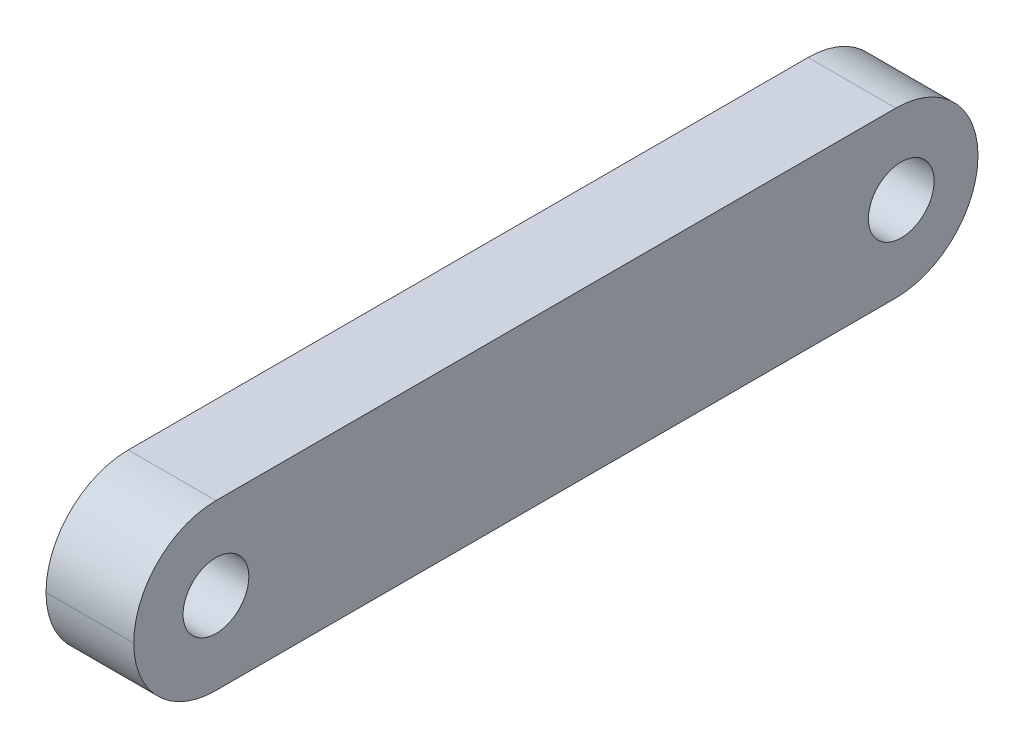
from build123d import *

# Parameters (mm, degrees)
SKETCH_1_W      = 15.4
SKETCH_1_H      = 3
SKETCH_1_R      = 0.6
EXTRUDE_1_DEPTH = 1.6
FILLET_1_R      = 1.5


with BuildPart() as part:
    # 草图1 → 凸台-拉伸1 (new body)
    with BuildSketch(Plane(origin=(0, 0, 0), x_dir=(0, 0, -1), z_dir=(1, 0, 0))):
        with Locations((7.7, -1.5)):
            Rectangle(SKETCH_1_W, SKETCH_1_H)
        with Locations((1.5, -1.5)):
            Circle(SKETCH_1_R, mode=Mode.SUBTRACT)
        with Locations((14, -1.5)):
            Circle(SKETCH_1_R, mode=Mode.SUBTRACT)
    extrude(amount=EXTRUDE_1_DEPTH)

    # 圆角1
    fillet_1_edges = [part.edges().sort_by_distance(p)[0] for p in [
        (0.8, -3, 0),
        (0.8, 0, 0),
        (0.8, -3, -15.4),
        (0.8, 0, -15.4),
    ]]
    fillet(fillet_1_edges, radius=FILLET_1_R - 0.0001)  # a hair under: the kernel refuses the full size


solid = part.part
